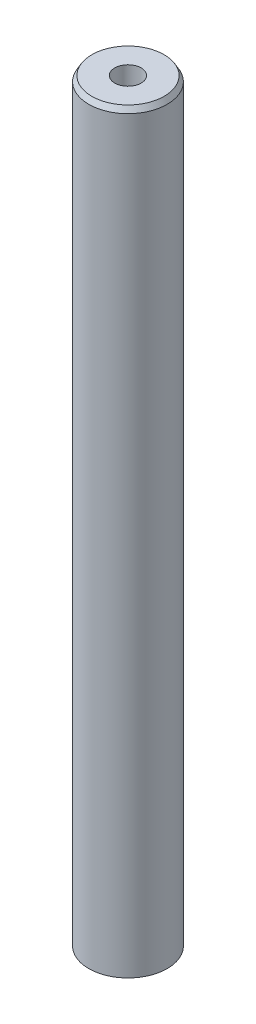
from build123d import *
from OCP.BRepFilletAPI import BRepFilletAPI_MakeChamfer

# Parameters (mm, degrees)
SKETCH1_R           = 12.5
BOSS_EXTRUDE1_DEPTH = 241.255241295
SKETCH2_R           = 4.204587298
CUT_EXTRUDE1_DEPTH  = 242.902028623
CHAMFER1_SIZE       = 1.706329527
CHAMFER1_SIZE2      = 0.985149812


with BuildPart() as part:
    # Sketch1 → Boss-Extrude1 (new body)
    with BuildSketch(Plane(origin=(0, 0, 0), x_dir=(1, 0, 0), z_dir=(0, 1, 0))):
        Circle(SKETCH1_R)
    extrude(amount=BOSS_EXTRUDE1_DEPTH)

    # Sketch2 → Cut-Extrude1 (cut, through all)
    with BuildSketch(Plane(origin=(0, 0, 0), x_dir=(1, 0, 0), z_dir=(0, 1, 0))):
        Circle(SKETCH2_R)
    extrude(amount=CUT_EXTRUDE1_DEPTH, mode=Mode.SUBTRACT)

    # Chamfer1: one chamfer whose edges measure the first distance from different faces: ONE call of the kernel's chamfer builder (chamfer() names one face for all edges)
    chamfer1_edges_1 = [part.edges().sort_by_distance(p)[0] for p in [
        (-12.5, 241.255241295, 0),
    ]]
    chamfer1_side_1 = [part.faces().sort_by_distance(p)[0] for p in [
        (-12.5, 120.627620647, 0),
    ]]
    chamfer1_edges_2 = [part.edges().sort_by_distance(p)[0] for p in [
        (-12.5, 0, 0),
    ]]
    chamfer1_side_2 = [part.faces().sort_by_distance(p)[0] for p in [
        (-12.146446609, 0, 0),
    ]]
    chamfer1 = BRepFilletAPI_MakeChamfer(part.part.solid().wrapped)
    for e in chamfer1_edges_1:
        chamfer1.Add(CHAMFER1_SIZE, CHAMFER1_SIZE2, e.wrapped, chamfer1_side_1[0].wrapped)  # the first distance lies on this face
    for e in chamfer1_edges_2:
        chamfer1.Add(CHAMFER1_SIZE, CHAMFER1_SIZE2, e.wrapped, chamfer1_side_2[0].wrapped)  # the first distance lies on this face
    add(Compound.cast(chamfer1.Shape()), mode=Mode.REPLACE)


solid = part.part
